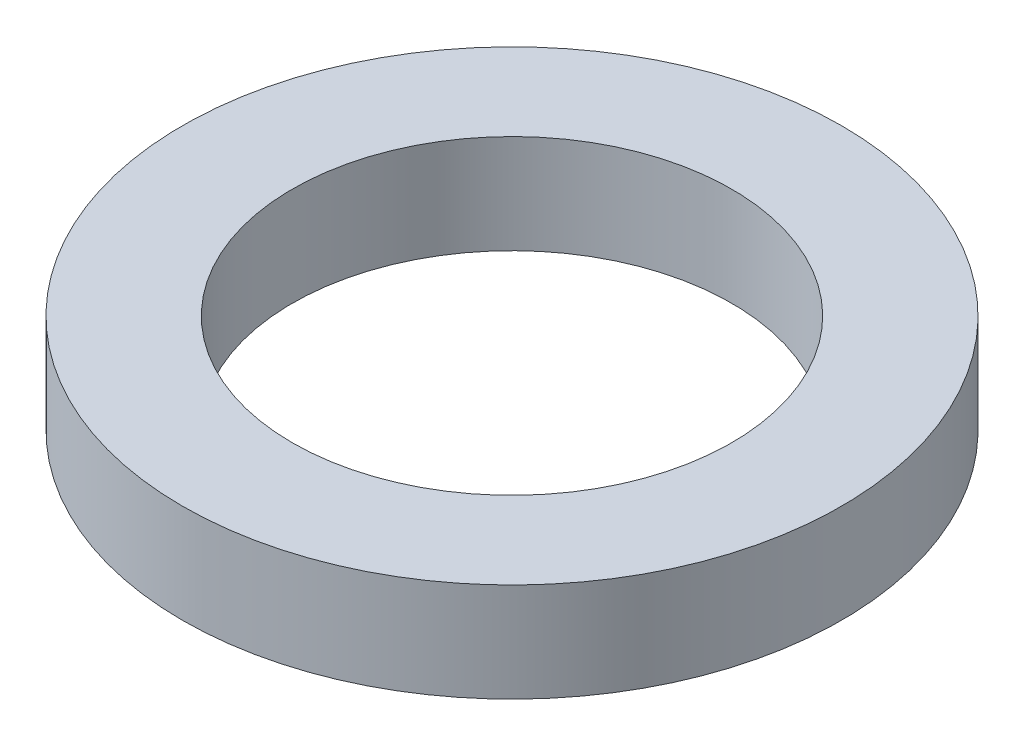
from build123d import *

# Parameters (mm, degrees)
SKETCH1_R           = 30
BOSS_EXTRUDE1_DEPTH = 9
SKETCH2_R           = 20
CUT_EXTRUDE1_DEPTH  = 44.370496884


with BuildPart() as part:
    # Sketch1 → Boss-Extrude1 (new body)
    with BuildSketch(Plane(origin=(0, 0, 0), x_dir=(1, 0, 0), z_dir=(0, 1, 0))):
        Circle(SKETCH1_R)
    extrude(amount=BOSS_EXTRUDE1_DEPTH)

    # Sketch2 → Cut-Extrude1 (cut, through all)
    with BuildSketch(Plane(origin=(0, 0, 0), x_dir=(1, 0, 0), z_dir=(0, 1, 0))):
        Circle(SKETCH2_R)
    extrude(amount=CUT_EXTRUDE1_DEPTH, mode=Mode.SUBTRACT)


solid = part.part
